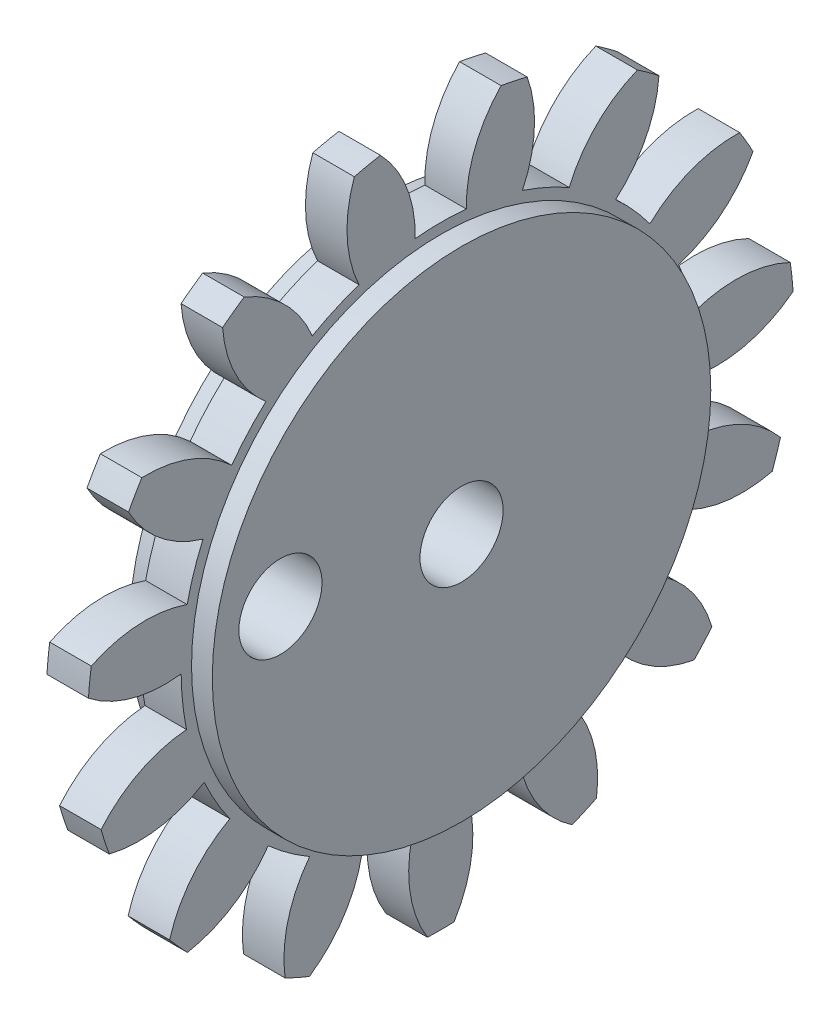
from build123d import *

# Parameters (mm, degrees)
BASPROSKE_W        = 6.35
BASPROSKE_H        = 53.975
TOOTHCUT_DEPTH     = 77.59584682
TEETHCUTS_COUNT    = 15
TEETHCUTS_ANGLE    = 336
HUBNEABOTSKE_R     = 38.1
HUBNEARBOTH_DEPTH  = 3.1750254
HUBFAR_START       = 3.1750254
HUBFARSKE_R        = 38.1
HUBFAR_DEPTH       = 3.1750254
BORSKE_R           = 6.35
BORE_DEPTH         = 12.7000508
SKETCH1_R          = 6.35
CUT_EXTRUDE1_DEPTH = 78.297193623


with BuildPart() as part:
    # BasProSke → Base-Revolve (revolve)
    with BuildSketch(Plane(origin=(0, 0, 0), x_dir=(1, 0, 0), z_dir=(0, 1, 0))):
        with Locations((3.175, 26.9875)):
            Rectangle(BASPROSKE_W, BASPROSKE_H)
    revolve(axis=Axis((-10, 0, 0), (1, 0, 0)))

    # TooCutSke → ToothCut (cut, through all)
    with BuildSketch(Plane(origin=(0, 0, 0), x_dir=(0, 0, -1), z_dir=(1, 0, 0))):
        with BuildLine():
            ThreePointArc((3.91547882, 39.492605349), (0, 39.68623), (-3.91547882, 39.492605349))
            ThreePointArc((-3.91547882, 39.492605349), (-5.201686692, 46.882953453), (-9.241355572, 53.20376441))
            ThreePointArc((-9.241355572, 53.20376441), (0, 54.0004), (9.241355572, 53.20376441))
            ThreePointArc((9.241355572, 53.20376441), (5.201686692, 46.882953453), (3.91547882, 39.492605349))
        make_face()
    toothcut = extrude(amount=TOOTHCUT_DEPTH, mode=Mode.SUBTRACT)

    # TeethCuts: ToothCut ×15 about axis
    teethcuts_axis = Axis((-10, 0, 0), (1, 0, 0))
    for i in range(1, TEETHCUTS_COUNT):
        add(toothcut.rotate(teethcuts_axis, i * TEETHCUTS_ANGLE / (TEETHCUTS_COUNT - 1)), mode=Mode.SUBTRACT)

    # HubNeaBotSke → HubNearBoth (add)
    with BuildSketch(Plane.ZY):
        Circle(HUBNEABOTSKE_R)
    extrude(amount=HUBNEARBOTH_DEPTH)

    # HubFarSke → HubFar (add)
    with BuildSketch(Plane(origin=(6.35, 0, 0), x_dir=(0, 0, -1), z_dir=(1, 0, 0)).offset(HUBFAR_START)):
        Circle(HUBFARSKE_R)
    extrude(amount=-HUBFAR_DEPTH)

    # BorSke → Bore (cut, symmetric)
    with BuildSketch(Plane(origin=(0, 0, 0), x_dir=(0, 0, -1), z_dir=(1, 0, 0))):
        Circle(BORSKE_R)
    extrude(amount=BORE_DEPTH, both=True, mode=Mode.SUBTRACT)

    # Sketch1 → Cut-Extrude1 (cut, through all)
    with BuildSketch(Plane.ZY.offset(3.1750254)):
        with Locations((27.682550617, 4.269063845)):
            Circle(SKETCH1_R)
    extrude(amount=-CUT_EXTRUDE1_DEPTH, mode=Mode.SUBTRACT)


solid = part.part
